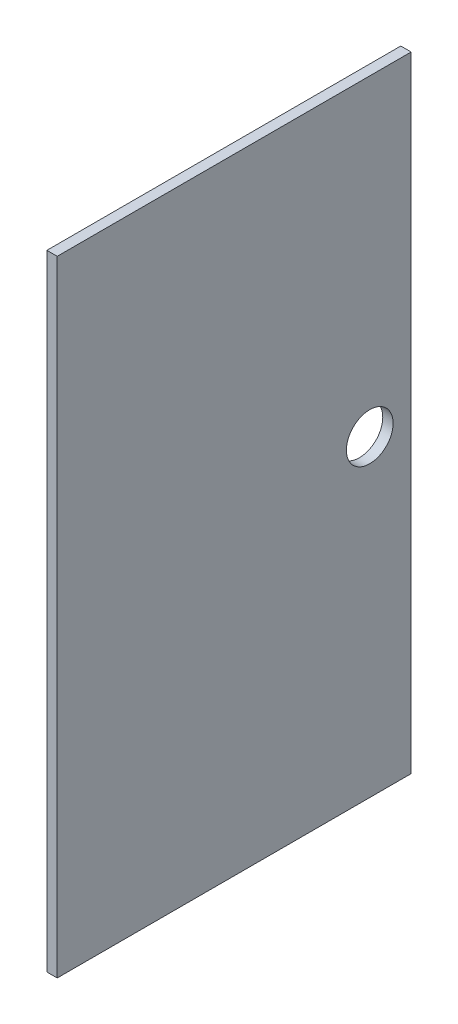
from build123d import *

# Parameters (mm, degrees)
SKETCH1_W               = 217.17
SKETCH1_H               = 383.54
BOSS_EXTRUDE1_DEPTH     = 6.35
CUT_EXTRUDE1_DEPTH      = 441.801614108
CUT_EXTRUDE1_DEPTH_BACK = 441.801614108
SKETCH2_R               = 14.351


with BuildPart() as part:
    # Sketch1 → Boss-Extrude1 (new body)
    with BuildSketch(Plane(origin=(0, 0, 0), x_dir=(0, 0, -1), z_dir=(1, 0, 0))):
        with Locations((108.585, 191.77)):
            Rectangle(SKETCH1_W, SKETCH1_H)
    extrude(amount=BOSS_EXTRUDE1_DEPTH)

    # Sketch2 → Cut-Extrude1 (cut, two sides: drawn at the far end of the back side and taken through both)
    with BuildSketch(Plane(origin=(6.35, 0, 0), x_dir=(0, 0, -1), z_dir=(1, 0, 0)).offset(-CUT_EXTRUDE1_DEPTH_BACK)):
        with Locations((191.77, 191.77)):
            Circle(SKETCH2_R)
    extrude(amount=CUT_EXTRUDE1_DEPTH + CUT_EXTRUDE1_DEPTH_BACK, mode=Mode.SUBTRACT)


solid = part.part
